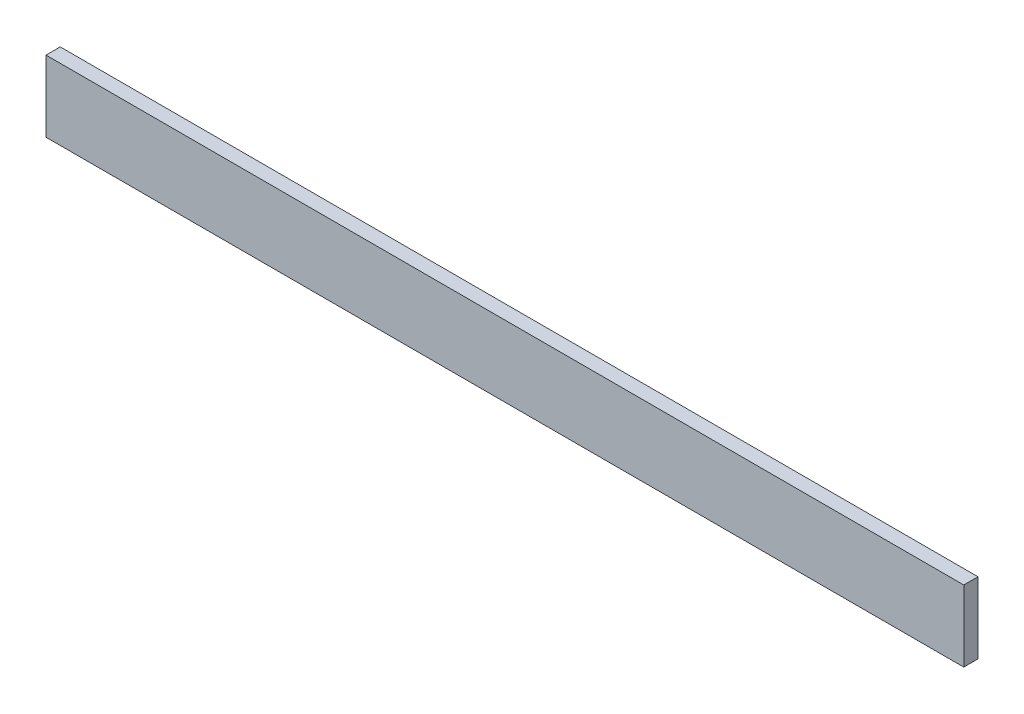
from build123d import *

# Parameters (mm, degrees)
ESBO_O1_W                = 129
ESBO_O1_H                = 10
RESSALTO_EXTRUS_O1_DEPTH = 2


with BuildPart() as part:
    # Esboço1 → Ressalto-extrusão1 (new body)
    with BuildSketch(Plane.XY):
        with Locations((-7.607871181, -5)):
            Rectangle(ESBO_O1_W, ESBO_O1_H)
    extrude(amount=RESSALTO_EXTRUS_O1_DEPTH)


solid = part.part
